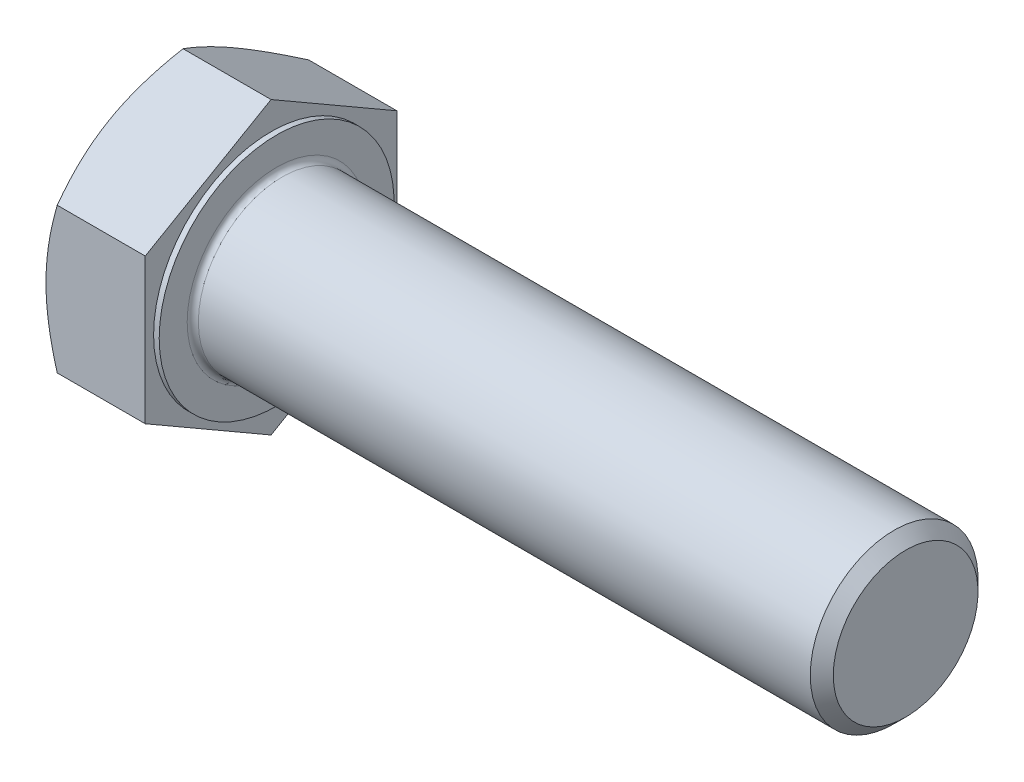
from build123d import *

# Parameters (mm, degrees)
BASEHEAD_DEPTH   = 15
BEARINGFACESKE_W = 0.8
BEARINGFACESKE_H = 3.979609691
FILLET_2_R       = 0.8


with BuildPart() as part:
    # BaseHeadSke → BaseHead (new body)
    with BuildSketch(Plane(origin=(0, 0, 0), x_dir=(0, 0, -1), z_dir=(1, 0, 0))):
        Polygon((18, 10.392304845), (0, 20.784609691), (-18, 10.392304845), (-18, -10.392304845), (0, -20.784609691), (18, -10.392304845), align=None)
    extrude(amount=BASEHEAD_DEPTH)

    # BodySke → BaseBody (revolve)
    with BuildSketch(Plane.XY):
        Polygon((0, 0), (105, 0), (105, 10.352), (103.352, 12), (0, 12), align=None)
    revolve(axis=Axis((0, 0, 0), (1, 0, 0)))

    # HeadChamferSke → HeadChamfer (revolve, cut)
    with BuildSketch(Plane.XY):
        Polygon((1.607695155, 20.784609691), (0, 20.784609691), (0, 18), align=None)
    revolve(axis=Axis((0, 0, 0), (1, 0, 0)), mode=Mode.SUBTRACT)

    # BearingFaceSke → BearingFace (revolve, cut)
    with BuildSketch(Plane.XY):
        with Locations((14.6, 18.794804845)):
            Rectangle(BEARINGFACESKE_W, BEARINGFACESKE_H)
    revolve(axis=Axis((0, 0, 0), (1, 0, 0)), mode=Mode.SUBTRACT)

    # Fillet 2
    fillet_2_edges = [part.edges().sort_by_distance(p)[0] for p in [
        (15, -12, 0),
    ]]
    fillet(fillet_2_edges, radius=FILLET_2_R)


solid = part.part
